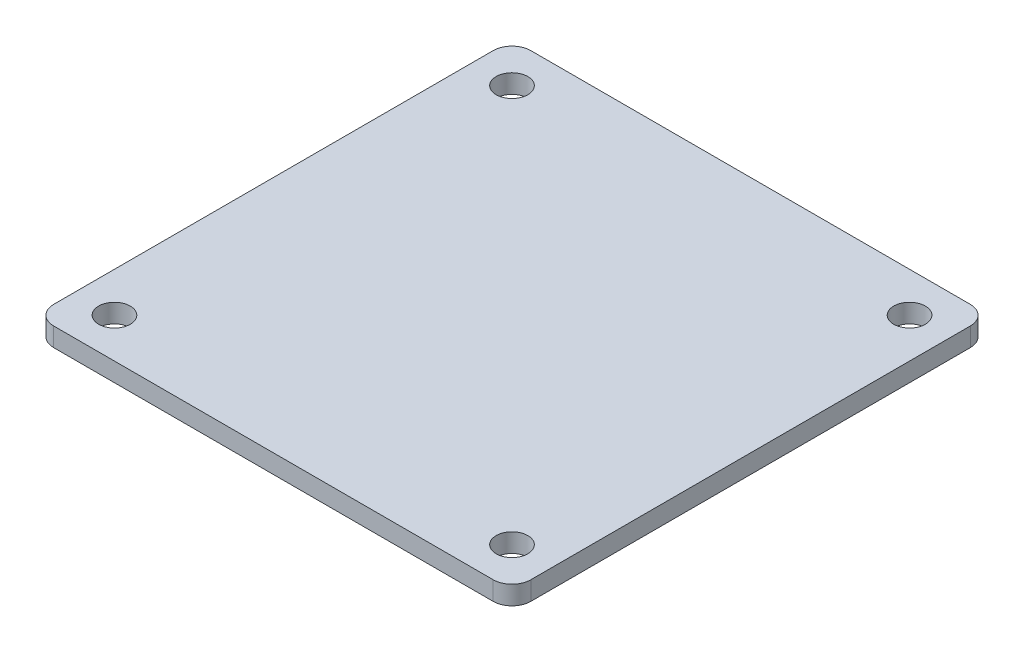
from build123d import *

# Parameters (mm, degrees)
SKETCH1_W           = 76.2
SKETCH1_H           = 76.2
SKETCH1_R           = 2.525
BOSS_EXTRUDE1_DEPTH = 3
FILLET1_R           = 3


with BuildPart() as part:
    # Sketch1 → Boss-Extrude1 (new body)
    with BuildSketch(Plane(origin=(0, 0, 0), x_dir=(1, 0, 0), z_dir=(0, 1, 0))):
        Rectangle(SKETCH1_W, SKETCH1_H)
        with Locations((-31.75, 31.75)):
            Circle(SKETCH1_R, mode=Mode.SUBTRACT)
        with Locations((31.75, 31.75)):
            Circle(SKETCH1_R, mode=Mode.SUBTRACT)
        with Locations((31.75, -31.75)):
            Circle(SKETCH1_R, mode=Mode.SUBTRACT)
        with Locations((-31.75, -31.75)):
            Circle(SKETCH1_R, mode=Mode.SUBTRACT)
    extrude(amount=BOSS_EXTRUDE1_DEPTH)

    # Fillet1
    fillet1_edges = [part.edges().sort_by_distance(p)[0] for p in [
        (38.1, 1.5, 38.1),
        (38.1, 1.5, -38.1),
        (-38.1, 1.5, -38.1),
        (-38.1, 1.5, 38.1),
    ]]
    fillet(fillet1_edges, radius=FILLET1_R)


solid = part.part
